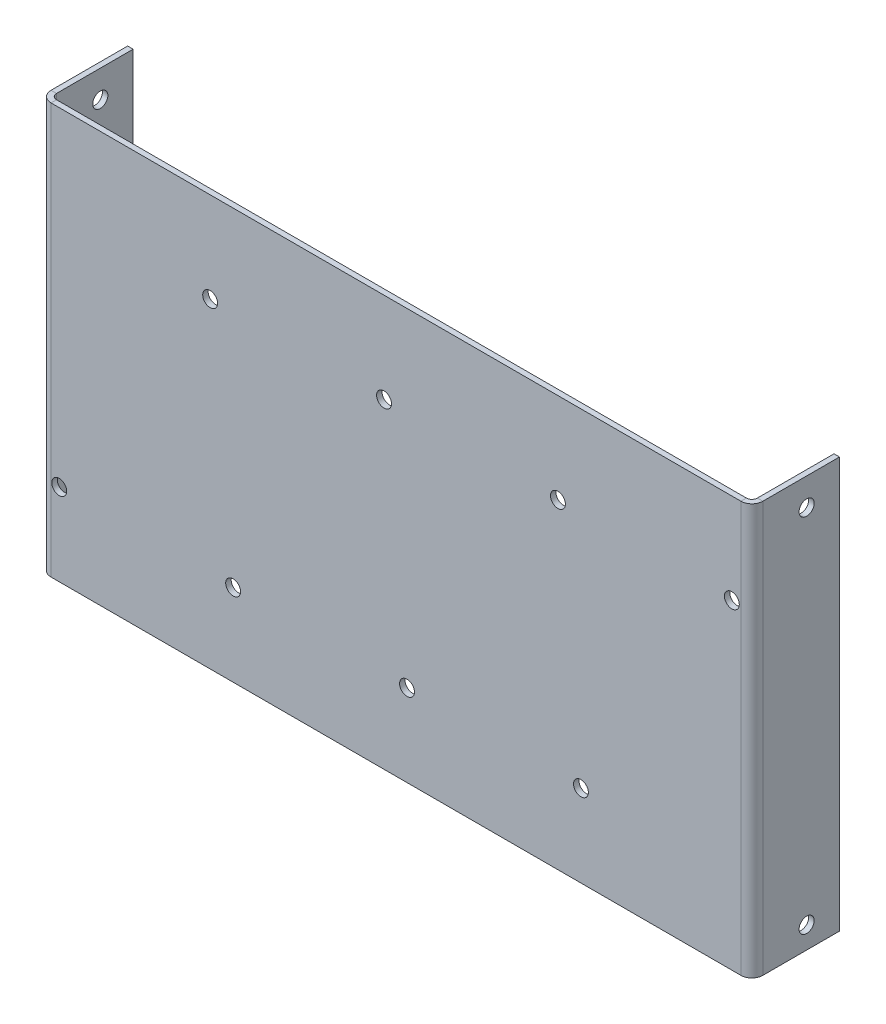
from build123d import *

# Parameters (mm, degrees)
SKETCH1_W              = 165.1
SKETCH1_H              = 95.25
BOSS_EXTRUDE1_DEPTH    = 1.27
SKETCH2_W              = 1.27
SKETCH2_H              = 95.25
BOSS_EXTRUDE2_DEPTH    = 19.05
CONVERT_SOLID1_START   = 35.497339992
CONVERT_SOLID1_DEPTH   = 95.25
CONVERT_SOLID1_2_DEPTH = 95.25
SKETCH7_R              = 1.7272
CUT_EXTRUDE1_DEPTH     = 215.065982678
SKETCH8_R              = 1.7526
CUT_EXTRUDE2_DEPTH     = 212.461058862


# Read off the part's stored shape, not the designer's step: Convert-Solid1
with BuildPart() as part:
    # Sketch1 → Boss-Extrude1 (new body)
    with BuildSketch(Plane.XY):
        with Locations((-85.725, 83.122339992)):
            Rectangle(SKETCH1_W, SKETCH1_H)
    extrude(amount=BOSS_EXTRUDE1_DEPTH)

    # Sketch2 → Boss-Extrude2 (add)
    with BuildSketch(Plane(origin=(0, 0, 0), x_dir=(-1, 0, 0), z_dir=(0, 0, -1))):
        with Locations((3.81, 83.122339992)):
            Rectangle(SKETCH2_W, SKETCH2_H)
        with Locations((167.64, 83.122339992)):
            Rectangle(SKETCH2_W, SKETCH2_H)
    extrude(amount=BOSS_EXTRUDE2_DEPTH)

    # Convert-Solid1 outline → Convert-Solid1 (cut)
    with BuildSketch(Plane(origin=(0, 0, 0), x_dir=(1, 0, 0), z_dir=(0, 1, 0)).offset(CONVERT_SOLID1_START)):
        with BuildLine():
            ThreePointArc((-3.175, 1.27), (-3.918948776, -0.526051224), (-5.715, -1.27))
            Line((-5.715, -1.27), (-3.175, -1.27))
            Line((-3.175, -1.27), (-3.175, 1.27))
        make_face()
        with BuildLine():
            ThreePointArc((-165.735, -1.27), (-167.531051224, -0.526051224), (-168.275, 1.27))
            Line((-168.275, 1.27), (-168.275, -1.27))
            Line((-168.275, -1.27), (-165.735, -1.27))
        make_face()
    extrude(amount=CONVERT_SOLID1_DEPTH, mode=Mode.SUBTRACT)

    # Convert-Solid1 2 outline → Convert-Solid1 2 (add)
    with BuildSketch(Plane(origin=(0, 0, 0), x_dir=(1, 0, 0), z_dir=(0, 1, 0)).offset(CONVERT_SOLID1_START)):
        with BuildLine():
            ThreePointArc((-4.445, 1.27), (-4.816974388, 0.371974388), (-5.715, 0))
            Line((-5.715, 0), (-4.445, 0))
            Line((-4.445, 0), (-4.445, 1.27))
        make_face()
        with BuildLine():
            ThreePointArc((-165.735, 0), (-166.633025612, 0.371974388), (-167.005, 1.27))
            Line((-167.005, 1.27), (-167.005, 0))
            Line((-167.005, 0), (-165.735, 0))
        make_face()
    extrude(amount=CONVERT_SOLID1_2_DEPTH)

    # Sketch7 → Cut-Extrude1 (cut, through all)
    with BuildSketch(Plane.XY.offset(1.27)):
        with Locations((-7.8232, 109.792339992)):
            Circle(SKETCH7_R)
        with Locations((-48.1584, 109.792339992)):
            Circle(SKETCH7_R)
        with Locations((-88.4936, 109.792339992)):
            Circle(SKETCH7_R)
        with Locations((-128.8288, 109.792339992)):
            Circle(SKETCH7_R)
        with Locations((-163.83, 54.547339992)):
            Circle(SKETCH7_R)
        with Locations((-123.4948, 54.547339992)):
            Circle(SKETCH7_R)
        with Locations((-83.1596, 54.547339992)):
            Circle(SKETCH7_R)
        with Locations((-42.8244, 54.547339992)):
            Circle(SKETCH7_R)
    extrude(amount=-CUT_EXTRUDE1_DEPTH, mode=Mode.SUBTRACT)

    # Sketch8 → Cut-Extrude2 (cut, through all)
    with BuildSketch(Plane.ZY.offset(168.275)):
        with Locations((-11.43, 40.577339992)):
            Circle(SKETCH8_R)
        with Locations((-11.43, 124.397339992)):
            Circle(SKETCH8_R)
    extrude(amount=-CUT_EXTRUDE2_DEPTH, mode=Mode.SUBTRACT)


solid = part.part
